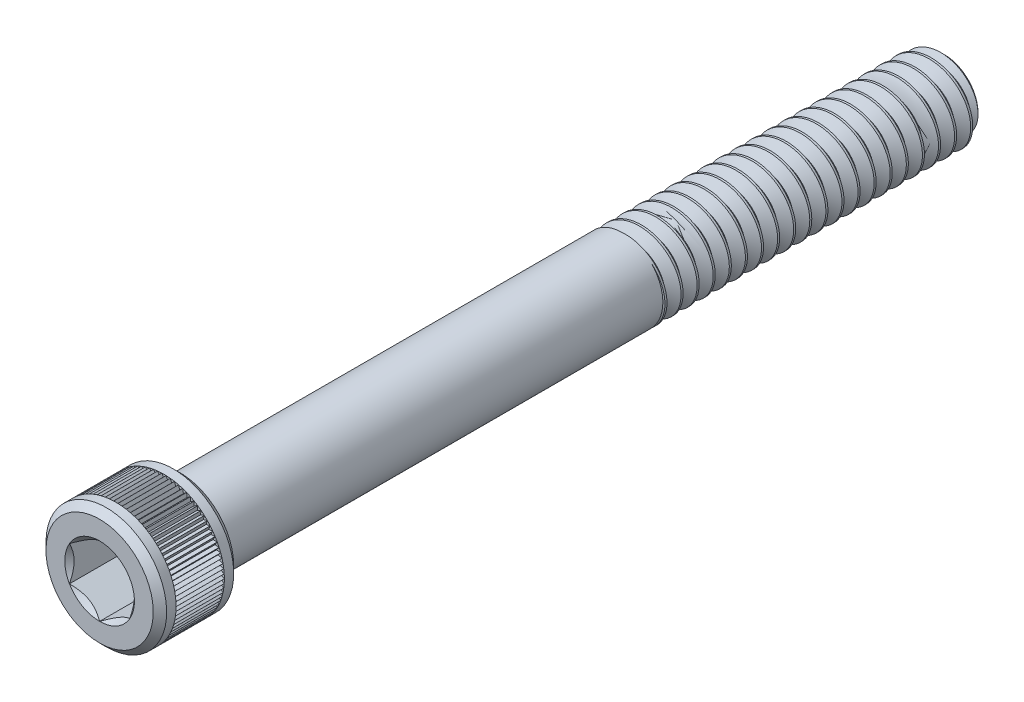
from build123d import *

# Parameters (mm, degrees)
CUT_EXTRUDE1_DEPTH = 4.7625
CUT_SWEEP1_PITCH   = 1.27
CUT_SWEEP1_TO      = 25.4
CUT_EXTRUDE3_START = 40.005
CUT_EXTRUDE3_DEPTH = 3.81
CIRPATTERN1_COUNT  = 90


with BuildPart() as part:
    # Sketch2 → Revolve1 (revolve)
    with BuildSketch(Plane(origin=(0, 0, 0), x_dir=(0, 0, -1), z_dir=(1, 0, 0)), mode=Mode.PRIVATE) as revolve1_sk:
        Polygon((-41.275, 0), (25.4, 0), (25.4, 2.645833333), (24.870833333, 3.175), (-34.925, 3.175), (-34.925, 4.233333333), (-35.454166667, 4.7625), (-40.745833333, 4.7625), (-41.275, 4.233333333), align=None)
    revolve(revolve1_sk.sketch.rotate(Axis((0, 0, 34.925), (0, 0, -1)), 180), axis=Axis((0, 0, 34.925), (0, 0, -1)))

    # Sketch3 → Cut-Extrude1 (cut)
    with BuildSketch(Plane.XY.offset(41.275)):
        Polygon((0, 2.749630657), (-2.38125, 1.374815329), (-2.38125, -1.374815329), (0, -2.749630657), (2.38125, -1.374815329), (2.38125, 1.374815329), align=None)
    extrude(amount=-CUT_EXTRUDE1_DEPTH, mode=Mode.SUBTRACT)

    # Cut-Extrude2 cone 1 section (through the dimple's axis) → Cut-Extrude2 (revolve, cut)
    with BuildSketch(Plane(origin=(0, 0, 41.275), x_dir=(0, -1, 0), z_dir=(1, 0, 0))):
        Polygon((0, 0), (2.749630657, 0), (0, 2.749630657), align=None)
    revolve(axis=Axis((0, 0, 41.275), (0, 0, -1)), mode=Mode.SUBTRACT)


with BuildPart() as body_2:
    # Split1: the piece on the far side of the plane
    add(part.part)
    split(bisect_by=Plane.XY, keep=Keep.BOTTOM)

    # Cut-Sweep1: arcs per turn and ends read off the stored shape
    # Cut-Sweep1: the profile of Sketch8 screwed along a right-hand helix through 22 turns, 8 arcs to a turn; built about Z, then put on its axis
    cut_sweep1_z = Axis((0, 0, 0), (0, 0, 1))
    cut_sweep1_corners = [(3.243740766, 0, 0.0396875), (3.243740766, 0, -1.1509375), (2.350110803, 0, -0.635), (2.350110803, 0, -0.47625)]
    with BuildLine(mode=Mode.PRIVATE) as cut_sweep1_profile:
        Line(cut_sweep1_corners[0], cut_sweep1_corners[1])
        Line(cut_sweep1_corners[1], cut_sweep1_corners[2])
        Line(cut_sweep1_corners[2], cut_sweep1_corners[3])
        Line(cut_sweep1_corners[3], cut_sweep1_corners[0])
    cut_sweep1_cap = Face(cut_sweep1_profile.wire())
    cut_sweep1_turn_angles = [0, 22.5, 45, 67.5, 90, 112.5, 135, 157.5, 180, 202.5, 225, 247.5, 270, 292.5, 315, 337.5, 360]
    cut_sweep1_turn_weights = [1, 0.9238795325112867, 1, 0.9238795325112867, 1, 0.9238795325112867, 1, 0.9238795325112867, 1, 0.9238795325112867, 1, 0.9238795325112867, 1, 0.9238795325112867, 1, 0.9238795325112867, 1]
    cut_sweep1_turn_rails = [Edge.make_bspline([Vector(p[0], p[1], 0).rotate(cut_sweep1_z, cut_sweep1_turn_angles[k]) / cut_sweep1_turn_weights[k] + Vector(0, 0, p[2] + CUT_SWEEP1_PITCH * cut_sweep1_turn_angles[k] / 360) for k in range(17)], [0, 0, 0, 1, 1, 2, 2, 3, 3, 4, 4, 5, 5, 6, 6, 7, 7, 8, 8, 8], 2, cut_sweep1_turn_weights) for p in cut_sweep1_corners]
    cut_sweep1_turn_sides = [Face.make_surface_from_curves(cut_sweep1_turn_rails[p[0]], cut_sweep1_turn_rails[p[1]]) for p in [(0, 1), (1, 2), (2, 3), (3, 0)]]
    cut_sweep1 = Plane(origin=(0, 0, -25.4), x_dir=(0, 1, 0), z_dir=(0, 0, 1)) * split(Solid(Shell([*[p.moved(Location((0, 0, CUT_SWEEP1_PITCH * i))) for i in range(22) for p in cut_sweep1_turn_sides], cut_sweep1_cap, cut_sweep1_cap.rotate(cut_sweep1_z, 7920).moved(Location((0, 0, CUT_SWEEP1_PITCH * 7920 / 360)))])), bisect_by=Plane.XY.offset(CUT_SWEEP1_TO), keep=Keep.BOTTOM, mode=Mode.PRIVATE)
    add(cut_sweep1, mode=Mode.SUBTRACT)


with BuildPart() as part_1:
    add(part.part)

    # Split1
    split(bisect_by=Plane.XY, keep=Keep.TOP)


with BuildPart() as body_2_1:
    add(body_2.part)

    # Combine1: union part
    add(part_1.part)

    # Sketch14 → Cut-Extrude3 (cut)
    with BuildSketch(Plane.XY.offset(CUT_EXTRUDE3_START)):
        Polygon((0.166310165, 4.7625), (0, 4.474442345), (-0.166310165, 4.7625), align=None)
    cut_extrude3 = extrude(amount=-CUT_EXTRUDE3_DEPTH, mode=Mode.SUBTRACT)

    # CirPattern1: Cut-Extrude3 ×90 about axis
    cirpattern1_axis = Axis((0, 0, 0), (0, 0, 1))
    for i in range(1, CIRPATTERN1_COUNT):
        add(cut_extrude3.rotate(cirpattern1_axis, i * 360 / CIRPATTERN1_COUNT), mode=Mode.SUBTRACT)


solid = body_2_1.part
